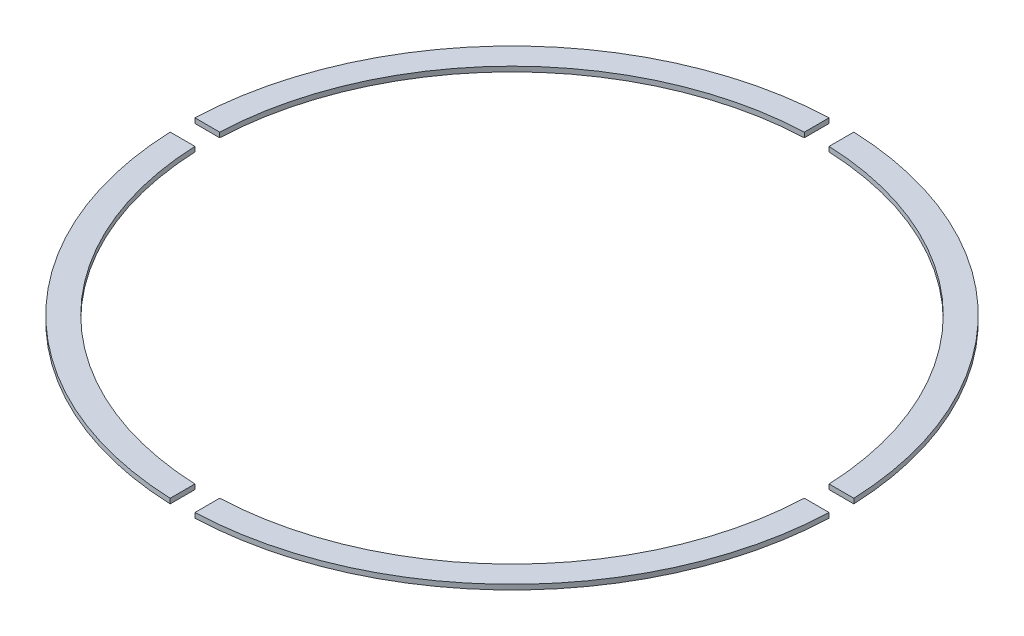
from build123d import *

# Parameters (mm, degrees)
SKETCH1_R           = 200
SKETCH1_R_2         = 185
BOSS_EXTRUDE1_DEPTH = 1.5
SKETCH2_W           = 69.71067633
SKETCH2_H           = 15
CUT_EXTRUDE1_DEPTH  = 283.846689922
CIRPATTERN1_COUNT   = 4


with BuildPart() as part:
    # Sketch1 → Boss-Extrude1 (new, symmetric)
    with BuildSketch(Plane(origin=(0, 0, 0), x_dir=(1, 0, 0), z_dir=(0, 1, 0))):
        Circle(SKETCH1_R)
        Circle(SKETCH1_R_2, mode=Mode.SUBTRACT)
    extrude(amount=BOSS_EXTRUDE1_DEPTH, both=True)

    # Sketch2 → Cut-Extrude1 (cut, symmetric)
    with BuildSketch(Plane(origin=(0, 0, 0), x_dir=(1, 0, 0), z_dir=(0, 1, 0))):
        with Locations((192.5, 0)):
            Rectangle(SKETCH2_W, SKETCH2_H)
    cut_extrude1 = extrude(amount=CUT_EXTRUDE1_DEPTH, both=True, mode=Mode.SUBTRACT)

    # CirPattern1: Cut-Extrude1 ×4 about axis
    cirpattern1_axis = Axis((0, 167.5, 0), (0, -1, 0))
    for i in range(1, CIRPATTERN1_COUNT):
        add(cut_extrude1.rotate(cirpattern1_axis, i * 360 / CIRPATTERN1_COUNT), mode=Mode.SUBTRACT)


solid = part.part
